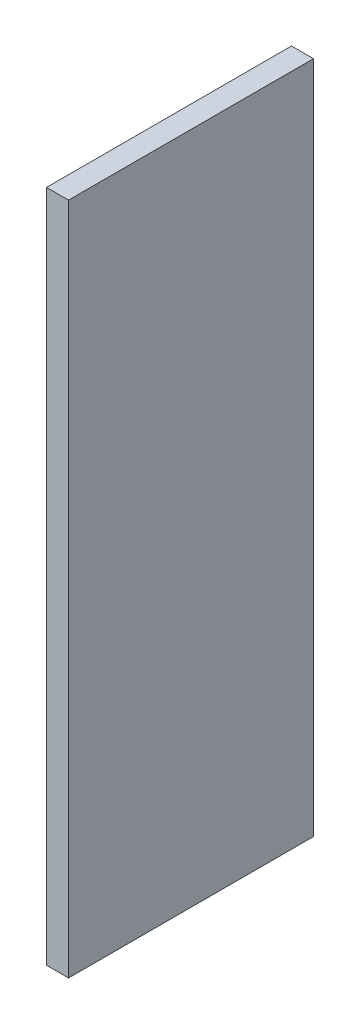
from build123d import *

# Parameters (mm, degrees)
SKETCH1_W           = 203.2
SKETCH1_H           = 558.8
BOSS_EXTRUDE1_DEPTH = 18.25625


with BuildPart() as part:
    # Sketch1 → Boss-Extrude1 (new body)
    with BuildSketch(Plane(origin=(0, 0, 0), x_dir=(0, 0, -1), z_dir=(1, 0, 0))):
        with Locations((71.133366082, 231.419612452)):
            Rectangle(SKETCH1_W, SKETCH1_H)
    extrude(amount=BOSS_EXTRUDE1_DEPTH)


solid = part.part
